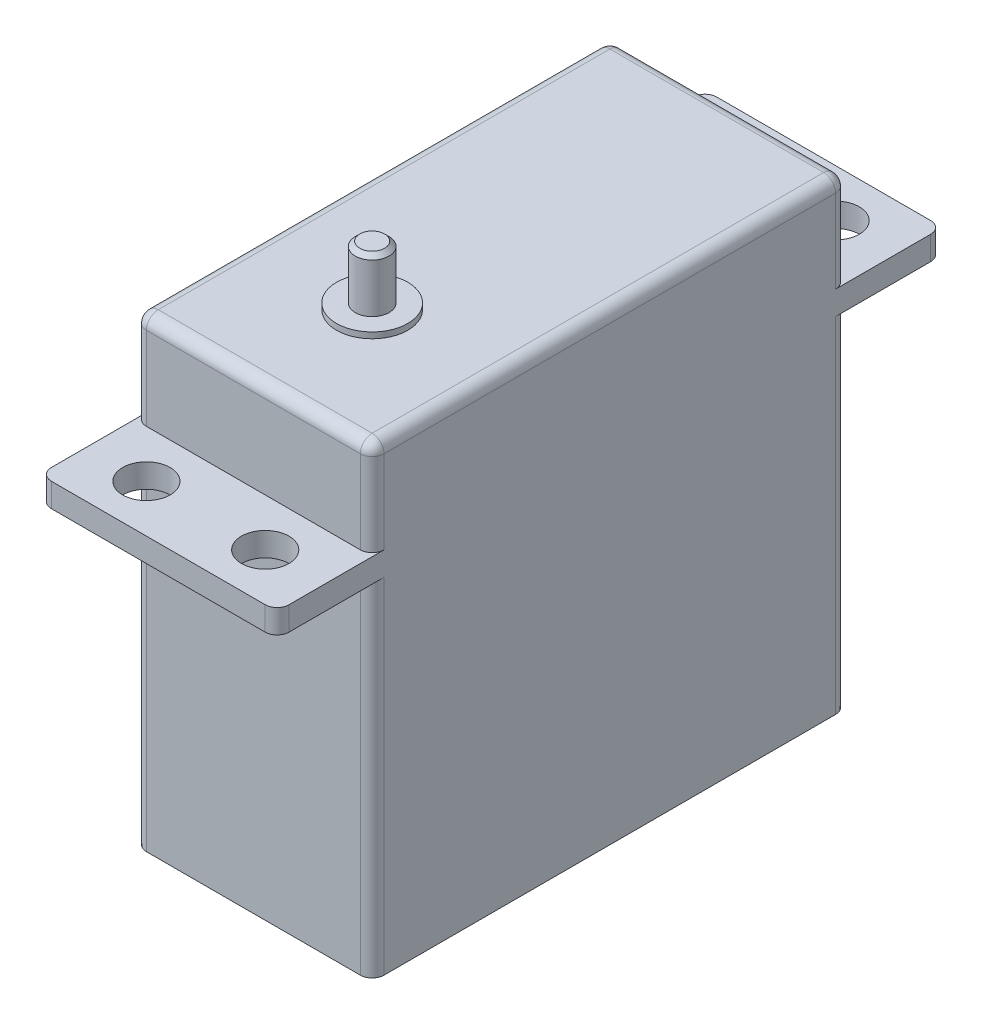
from build123d import *

# Parameters (mm, degrees)
SKETCH_1_W          = 40
SKETCH_1_H          = 39
EXTRUDE_1_DEPTH     = 20
SKETCH_2_W          = 20
SKETCH_2_H          = 2
EXTRUDE_2_DEPTH     = 8
SKETCH_3_W          = 20
SKETCH_3_H          = 2
EXTRUDE_3_DEPTH     = 8
CUT_EXTRUDE_3_REACH = 62.539
SKETCH_4_R          = 2
CUT_EXTRUDE_5_REACH = 62.539
SKETCH_5_R          = 2
SKETCH_7_R          = 3
EXTRUDE_5_DEPTH     = 0.5
SKETCH_9_R          = 1.5
EXTRUDE_6_DEPTH     = 5
FILLET_7_R          = 1
FILLET_8_R          = 1
FILLET_9_R          = 1
FILLET_10_R         = 1


# Read off the part's stored shape, not the designer's step: #4-40 机械螺纹 螺柱3
with BuildPart() as part:
    # 草图1 → 凸台-拉伸1 (new body)
    with BuildSketch(Plane(origin=(0, 0, 0), x_dir=(0, 0, -1), z_dir=(1, 0, 0))):
        with Locations((20, 19.5)):
            Rectangle(SKETCH_1_W, SKETCH_1_H)
    extrude(amount=EXTRUDE_1_DEPTH)

    # 草图2 → 凸台-拉伸2 (add)
    with BuildSketch(Plane.XY):
        with Locations((10, 30)):
            Rectangle(SKETCH_2_W, SKETCH_2_H)
    extrude(amount=EXTRUDE_2_DEPTH)

    # 草图3 → 凸台-拉伸3 (add)
    with BuildSketch(Plane(origin=(0, 0, -40), x_dir=(-1, 0, 0), z_dir=(0, 0, -1))):
        with Locations((-10, 30)):
            Rectangle(SKETCH_3_W, SKETCH_3_H)
    extrude(amount=EXTRUDE_3_DEPTH)

    # 草图4 → 切除-拉伸3 (cut, up to next)
    with BuildSketch(Plane(origin=(0, 31, 0), x_dir=(1, 0, 0), z_dir=(0, 1, 0)), mode=Mode.PRIVATE) as cut_extrude_3_sk1:
        with Locations(Location((5, -4, 0), (0, 0, 180))):
            Circle(SKETCH_4_R)
    cut_extrude_3_tool1 = extrude(cut_extrude_3_sk1.sketch, amount=-CUT_EXTRUDE_3_REACH, mode=Mode.PRIVATE) & part.part
    # 草图4 → 切除-拉伸3 (cut, up to next)
    with BuildSketch(Plane(origin=(0, 31, 0), x_dir=(1, 0, 0), z_dir=(0, 1, 0)), mode=Mode.PRIVATE) as cut_extrude_3_sk2:
        with Locations(Location((15, -4, 0), (0, 0, 180))):
            Circle(SKETCH_4_R)
    cut_extrude_3_tool2 = extrude(cut_extrude_3_sk2.sketch, amount=-CUT_EXTRUDE_3_REACH, mode=Mode.PRIVATE) & part.part
    add(cut_extrude_3_tool1.solids().sort_by_distance((5, 31, 4))[0], mode=Mode.SUBTRACT)
    add(cut_extrude_3_tool2.solids().sort_by_distance((15, 31, 4))[0], mode=Mode.SUBTRACT)

    # 草图5 → 切除-拉伸5 (cut, up to next)
    with BuildSketch(Plane(origin=(0, 31, 0), x_dir=(1, 0, 0), z_dir=(0, 1, 0)), mode=Mode.PRIVATE) as cut_extrude_5_sk1:
        with Locations(Location((5, 44, 0), (0, 0, 270))):
            Circle(SKETCH_5_R)
    cut_extrude_5_tool1 = extrude(cut_extrude_5_sk1.sketch, amount=-CUT_EXTRUDE_5_REACH, mode=Mode.PRIVATE) & part.part
    # 草图5 → 切除-拉伸5 (cut, up to next)
    with BuildSketch(Plane(origin=(0, 31, 0), x_dir=(1, 0, 0), z_dir=(0, 1, 0)), mode=Mode.PRIVATE) as cut_extrude_5_sk2:
        with Locations(Location((15, 44, 0), (0, 0, 270))):
            Circle(SKETCH_5_R)
    cut_extrude_5_tool2 = extrude(cut_extrude_5_sk2.sketch, amount=-CUT_EXTRUDE_5_REACH, mode=Mode.PRIVATE) & part.part
    add(cut_extrude_5_tool1.solids().sort_by_distance((5, 31, -44))[0], mode=Mode.SUBTRACT)
    add(cut_extrude_5_tool2.solids().sort_by_distance((15, 31, -44))[0], mode=Mode.SUBTRACT)

    # 草图7 → 凸台-拉伸5 (add)
    with BuildSketch(Plane(origin=(0, 39, 0), x_dir=(1, 0, 0), z_dir=(0, 1, 0))):
        with Locations(Location((10, 10, 0), (0, 0, 90))):
            Circle(SKETCH_7_R)
    extrude(amount=EXTRUDE_5_DEPTH)

    # 草图9 → 凸台-拉伸6 (add)
    with BuildSketch(Plane(origin=(0, 39, 0), x_dir=(1, 0, 0), z_dir=(0, 1, 0))):
        with Locations(Location((10, 10, 0), (0, 0, 270))):
            Circle(SKETCH_9_R)
    extrude(amount=EXTRUDE_6_DEPTH)

    # 圆角7
    fillet_7_edges = [part.edges().sort_by_distance(p)[0] for p in [
        (20, 39, -20),
        (0, 35, -40),
        (20, 35, -40),
        (20, 35, 0),
        (0, 39, -20),
        (0, 35, 0),
        (10, 39, 0),
        (10, 39, -40),
    ]]
    fillet(fillet_7_edges, radius=FILLET_7_R)

    # 圆角8
    fillet_8_edges = [part.edges().sort_by_distance(p)[0] for p in [
        (20, 30, 8),
        (0, 30, 8),
    ]]
    fillet(fillet_8_edges, radius=FILLET_8_R)

    # 圆角9
    fillet_9_edges = [part.edges().sort_by_distance(p)[0] for p in [
        (0, 30, -48),
        (20, 30, -48),
    ]]
    fillet(fillet_9_edges, radius=FILLET_9_R)

    # #4-40 机械螺纹 螺柱3 outline → #4-40 机械螺纹 螺柱3 (revolve, cut)
    with BuildSketch(Plane(origin=(10, 0, -10), x_dir=(1, 0, 0), z_dir=(0, 0, 1))):
        Polygon((1.5, 44), (1.04394, 44), (1.4224, 43.62154), (1.4224, 39.5), (1.5, 39.5), align=None)
    revolve(axis=Axis((10, 0, -10), (0, 1, 0)), mode=Mode.SUBTRACT)

    # 圆角10
    fillet_10_edges = [part.edges().sort_by_distance(p)[0] for p in [
        (20, 14.5, -40),
        (0, 14.5, 0),
        (20, 14.5, 0),
        (0, 14.5, -40),
    ]]
    fillet(fillet_10_edges, radius=FILLET_10_R)


solid = part.part
